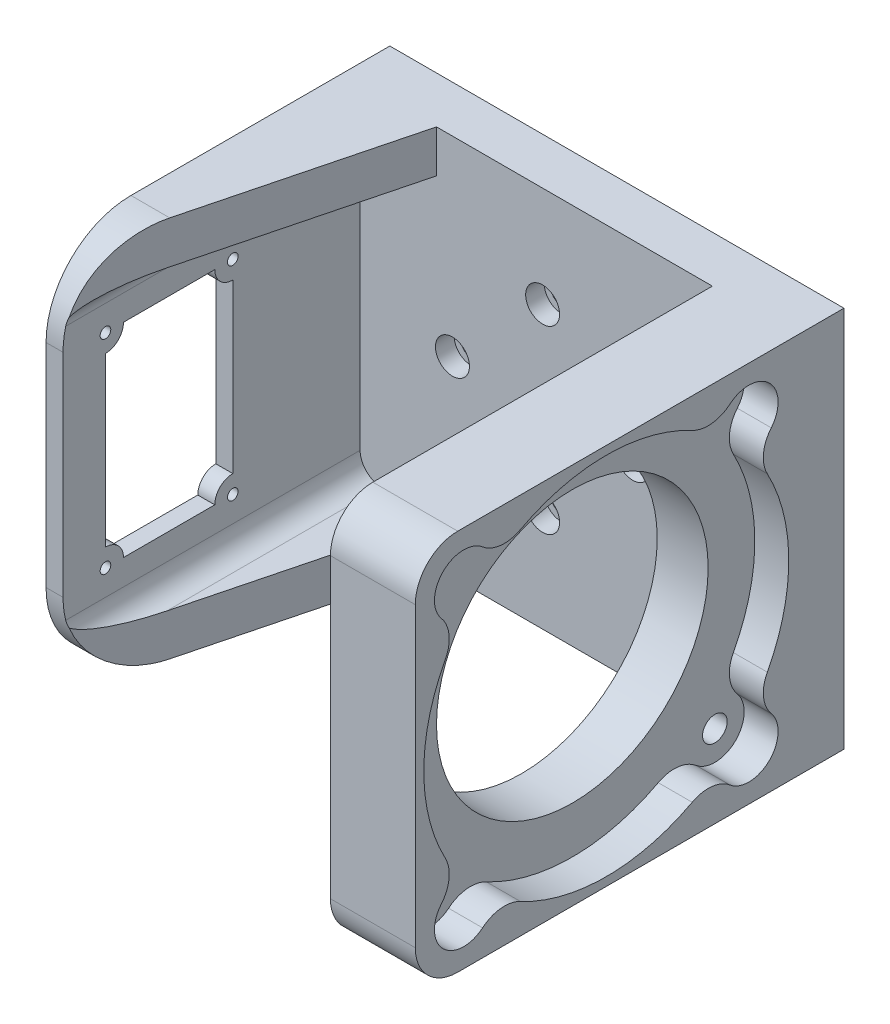
from build123d import *

# Parameters (mm, degrees)
SKETCH1_W                                           = 120
SKETCH1_H                                           = 90
SKETCH1_R                                           = 41.25
BOSS_EXTRUDE1_DEPTH                                 = 3
SKETCH2_W                                           = 120
SKETCH2_H                                           = 90
BOSS_EXTRUDE2_DEPTH                                 = 8
CBORE_FOR_M4_HEX_SOCKET_HEAD_CAP_SCREW1_D           = 4.8
CBORE_FOR_M4_HEX_SOCKET_HEAD_CAP_SCREW1_CBORE_D     = 8
CBORE_FOR_M4_HEX_SOCKET_HEAD_CAP_SCREW1_CBORE_DEPTH = 4.4
SKETCH5_W                                           = 20
SKETCH5_H                                           = 90
BOSS_EXTRUDE3_DEPTH                                 = 90
SKETCH8_R                                           = 32
CUT_EXTRUDE3_DEPTH                                  = 150.083869013
M5_CLEARANCE_HOLE1_D                                = 5.8
CUT_EXTRUDE4_START                                  = -8
SKETCH13_R                                          = 43
SKETCH13_R_2                                        = 6.9
SKETCH13_R_3                                        = 2.9
SKETCH13_R_4                                        = 32
CUT_EXTRUDE4_DEPTH                                  = 8
FILLET1_R                                           = 8
SKETCH14_W                                          = 17
SKETCH14_H                                          = 90
BOSS_EXTRUDE4_DEPTH                                 = 70
TAP_DRILL_FOR_M3_TAP2_D                             = 2.5
CUT_EXTRUDE5_DEPTH                                  = 152.112541008
SKETCH21_W                                          = 81
SKETCH21_H                                          = 90
CUT_EXTRUDE6_DEPTH                                  = 13
BOSS_EXTRUDE5_DEPTH                                 = 10
BOSS_EXTRUDE6_START                                 = -90
BOSS_EXTRUDE6_DEPTH                                 = 10
FILLET3_R                                           = 5
FILLET2_R                                           = 20
FILLET4_R                                           = 10


with BuildPart() as part:
    # Sketch1 → Boss-Extrude1 (new body)
    with BuildSketch(Plane.XY):
        Rectangle(SKETCH1_W, SKETCH1_H)
        Circle(SKETCH1_R, mode=Mode.SUBTRACT)
    extrude(amount=BOSS_EXTRUDE1_DEPTH)

    # Sketch2 → Boss-Extrude2 (add)
    with BuildSketch(Plane.XY.offset(3)):
        Rectangle(SKETCH2_W, SKETCH2_H)
    extrude(amount=BOSS_EXTRUDE2_DEPTH)

    # CBORE for M4 Hex Socket Head Cap Screw1 (through all)
    with Locations(Plane.XY.offset(11)):
        with Locations((-21.25, 0), (0, 21.25), (21.25, 0), (0, -21.25)):
            CounterBoreHole(CBORE_FOR_M4_HEX_SOCKET_HEAD_CAP_SCREW1_D / 2, CBORE_FOR_M4_HEX_SOCKET_HEAD_CAP_SCREW1_CBORE_D / 2, CBORE_FOR_M4_HEX_SOCKET_HEAD_CAP_SCREW1_CBORE_DEPTH)

    # Sketch5 → Boss-Extrude3 (add)
    with BuildSketch(Plane.XY.offset(11)):
        with Locations((50, 0)):
            Rectangle(SKETCH5_W, SKETCH5_H)
    extrude(amount=BOSS_EXTRUDE3_DEPTH)

    # Sketch8 → Cut-Extrude3 (cut, through all)
    with BuildSketch(Plane.ZY.offset(-40)):
        with Locations(Location((56, 0, 0), (0, 0, 270))):
            Circle(SKETCH8_R)
    extrude(amount=-CUT_EXTRUDE3_DEPTH, mode=Mode.SUBTRACT)

    # M5 Clearance Hole1 (through all)
    with Locations(Plane(origin=(60, 0, 0), x_dir=(0, 0, -1), z_dir=(1, 0, 0))):
        with Locations((-22.412427894, -33.587572106), (-89.587572106, -33.587572106), (-89.587572106, 33.587572106), (-22.412427894, 33.587572106)):
            Hole(M5_CLEARANCE_HOLE1_D / 2)

    # Sketch13 → Cut-Extrude4 (cut)
    # profile 1 of 22: a face of its own
    with BuildSketch(Plane(origin=(60, 0, 0), x_dir=(0, 0, -1), z_dir=(1, 0, 0)).offset(CUT_EXTRUDE4_START)):
        with Locations((-56, 0)):
            Circle(SKETCH13_R)
    # profile 2 of 22: a face of its own
    with BuildSketch(Plane(origin=(60, 0, 0), x_dir=(0, 0, -1), z_dir=(1, 0, 0)).offset(CUT_EXTRUDE4_START)):
        with Locations((-89.587572106, 33.587572106)):
            Circle(SKETCH13_R_2)
        with Locations((-89.587572106, 33.587572106)):
            Circle(SKETCH13_R_3, mode=Mode.SUBTRACT)
    # profile 3 of 22: a face of its own
    with BuildSketch(Plane(origin=(60, 0, 0), x_dir=(0, 0, -1), z_dir=(1, 0, 0)).offset(CUT_EXTRUDE4_START)):
        with Locations((-56, 0)):
            Circle(SKETCH13_R)
    # profile 4 of 22: a face of its own
    with BuildSketch(Plane(origin=(60, 0, 0), x_dir=(0, 0, -1), z_dir=(1, 0, 0)).offset(CUT_EXTRUDE4_START)):
        with Locations((-89.587572106, 33.587572106)):
            Circle(SKETCH13_R_2)
    # profile 5 of 22: a face of its own
    with BuildSketch(Plane(origin=(60, 0, 0), x_dir=(0, 0, -1), z_dir=(1, 0, 0)).offset(CUT_EXTRUDE4_START)):
        with Locations((-22.412427894, 33.587572106)):
            Circle(SKETCH13_R_2)
    # profile 6 of 22: a face of its own
    with BuildSketch(Plane(origin=(60, 0, 0), x_dir=(0, 0, -1), z_dir=(1, 0, 0)).offset(CUT_EXTRUDE4_START)):
        with Locations((-56, 0)):
            Circle(SKETCH13_R)
        with Locations(Location((-56, 0, 0), (0, 0, 270))):
            Circle(SKETCH13_R_4, mode=Mode.SUBTRACT)
    # profile 7 of 22: a face of its own
    with BuildSketch(Plane(origin=(60, 0, 0), x_dir=(0, 0, -1), z_dir=(1, 0, 0)).offset(CUT_EXTRUDE4_START)):
        with Locations((-89.587572106, 33.587572106)):
            Circle(SKETCH13_R_2)
    # profile 8 of 22: a face of its own
    with BuildSketch(Plane(origin=(60, 0, 0), x_dir=(0, 0, -1), z_dir=(1, 0, 0)).offset(CUT_EXTRUDE4_START)):
        with Locations((-89.587572106, -33.587572106)):
            Circle(SKETCH13_R_2)
    # profile 9 of 22: a face of its own
    with BuildSketch(Plane(origin=(60, 0, 0), x_dir=(0, 0, -1), z_dir=(1, 0, 0)).offset(CUT_EXTRUDE4_START)):
        with Locations((-22.412427894, -33.587572106)):
            Circle(SKETCH13_R_2)
    # profile 10 of 22: a face of its own
    with BuildSketch(Plane(origin=(60, 0, 0), x_dir=(0, 0, -1), z_dir=(1, 0, 0)).offset(CUT_EXTRUDE4_START)):
        with Locations((-56, 0)):
            Circle(SKETCH13_R)
    # profile 11 of 22: a face of its own
    with BuildSketch(Plane(origin=(60, 0, 0), x_dir=(0, 0, -1), z_dir=(1, 0, 0)).offset(CUT_EXTRUDE4_START)):
        with Locations((-22.412427894, 33.587572106)):
            Circle(SKETCH13_R_2)
    # profile 12 of 22: a face of its own
    with BuildSketch(Plane(origin=(60, 0, 0), x_dir=(0, 0, -1), z_dir=(1, 0, 0)).offset(CUT_EXTRUDE4_START)):
        with Locations((-56, 0)):
            Circle(SKETCH13_R)
    # profile 13 of 22: a face of its own
    with BuildSketch(Plane(origin=(60, 0, 0), x_dir=(0, 0, -1), z_dir=(1, 0, 0)).offset(CUT_EXTRUDE4_START)):
        with Locations((-22.412427894, 33.587572106)):
            Circle(SKETCH13_R_2)
        with Locations((-22.412427894, 33.587572106)):
            Circle(SKETCH13_R_3, mode=Mode.SUBTRACT)
    # profile 14 of 22: a face of its own
    with BuildSketch(Plane(origin=(60, 0, 0), x_dir=(0, 0, -1), z_dir=(1, 0, 0)).offset(CUT_EXTRUDE4_START)):
        with Locations((-56, 0)):
            Circle(SKETCH13_R)
    # profile 15 of 22: a face of its own
    with BuildSketch(Plane(origin=(60, 0, 0), x_dir=(0, 0, -1), z_dir=(1, 0, 0)).offset(CUT_EXTRUDE4_START)):
        with Locations((-22.412427894, -33.587572106)):
            Circle(SKETCH13_R_2)
    # profile 16 of 22: a face of its own
    with BuildSketch(Plane(origin=(60, 0, 0), x_dir=(0, 0, -1), z_dir=(1, 0, 0)).offset(CUT_EXTRUDE4_START)):
        with Locations((-56, 0)):
            Circle(SKETCH13_R)
    # profile 17 of 22: a face of its own
    with BuildSketch(Plane(origin=(60, 0, 0), x_dir=(0, 0, -1), z_dir=(1, 0, 0)).offset(CUT_EXTRUDE4_START)):
        with Locations((-22.412427894, -33.587572106)):
            Circle(SKETCH13_R_2)
        with Locations((-22.412427894, -33.587572106)):
            Circle(SKETCH13_R_3, mode=Mode.SUBTRACT)
    # profile 18 of 22: a face of its own
    with BuildSketch(Plane(origin=(60, 0, 0), x_dir=(0, 0, -1), z_dir=(1, 0, 0)).offset(CUT_EXTRUDE4_START)):
        with Locations((-56, 0)):
            Circle(SKETCH13_R)
    # profile 19 of 22: a face of its own
    with BuildSketch(Plane(origin=(60, 0, 0), x_dir=(0, 0, -1), z_dir=(1, 0, 0)).offset(CUT_EXTRUDE4_START)):
        with Locations((-89.587572106, -33.587572106)):
            Circle(SKETCH13_R_2)
    # profile 20 of 22: a face of its own
    with BuildSketch(Plane(origin=(60, 0, 0), x_dir=(0, 0, -1), z_dir=(1, 0, 0)).offset(CUT_EXTRUDE4_START)):
        with Locations((-56, 0)):
            Circle(SKETCH13_R)
    # profile 21 of 22: a face of its own
    with BuildSketch(Plane(origin=(60, 0, 0), x_dir=(0, 0, -1), z_dir=(1, 0, 0)).offset(CUT_EXTRUDE4_START)):
        with Locations((-89.587572106, -33.587572106)):
            Circle(SKETCH13_R_2)
        with Locations((-89.587572106, -33.587572106)):
            Circle(SKETCH13_R_3, mode=Mode.SUBTRACT)
    # profile 22 of 22: a face of its own
    with BuildSketch(Plane(origin=(60, 0, 0), x_dir=(0, 0, -1), z_dir=(1, 0, 0)).offset(CUT_EXTRUDE4_START)):
        with Locations((-22.412427894, -33.587572106)):
            Circle(SKETCH13_R_3)
    extrude(amount=CUT_EXTRUDE4_DEPTH, mode=Mode.SUBTRACT)

    # Fillet1
    fillet1_edges = [part.edges().sort_by_distance(p)[0] for p in [
        (56, 26.688751419, 89.715138257),
        (56, 33.715138257, 82.688751419),
        (56, 33.715138257, 29.311248581),
        (56, 26.688751419, 22.284861743),
        (56, -26.688751419, 22.284861743),
        (56, -33.715138257, 29.311248581),
        (56, -33.715138257, 82.688751419),
        (56, -26.688751419, 89.715138257),
    ]]
    fillet(fillet1_edges, radius=FILLET1_R)

    # Sketch14 → Boss-Extrude4 (add)
    with BuildSketch(Plane.XY.offset(11)):
        with Locations((-51.5, 0)):
            Rectangle(SKETCH14_W, SKETCH14_H)
    extrude(amount=BOSS_EXTRUDE4_DEPTH)

    # Tap Drill for M3 Tap2 (through all)
    with Locations(Plane(origin=(-43, 0, 0), x_dir=(0, 0, -1), z_dir=(1, 0, 0))):
        with Locations((-71, -24), (-71, 24), (-41, -24), (-41, 24)):
            Hole(TAP_DRILL_FOR_M3_TAP2_D / 2)

    # Sketch20 → Cut-Extrude5 (cut, through all)
    with BuildSketch(Plane(origin=(-43, 0, 0), x_dir=(0, 0, -1), z_dir=(1, 0, 0))):
        with BuildLine():
            ThreePointArc((-66.75, 24), (-67.99479618, 20.99479618), (-71, 19.75))
            Line((-71, 19.75), (-71, -19.75))
            ThreePointArc((-71, -19.75), (-67.99479618, -20.99479618), (-66.75, -24))
            Line((-66.75, -24), (-45.25, -24))
            ThreePointArc((-45.25, -24), (-44.00520382, -20.99479618), (-41, -19.75))
            Line((-41, -19.75), (-41, 19.75))
            ThreePointArc((-41, 19.75), (-44.00520382, 20.99479618), (-45.25, 24))
            Line((-45.25, 24), (-66.75, 24))
        make_face()
    extrude(amount=-CUT_EXTRUDE5_DEPTH, mode=Mode.SUBTRACT)

    # Sketch21 → Cut-Extrude6 (cut)
    with BuildSketch(Plane.ZY.offset(60)):
        with Locations((40.5, 0)):
            Rectangle(SKETCH21_W, SKETCH21_H)
    extrude(amount=-CUT_EXTRUDE6_DEPTH, mode=Mode.SUBTRACT)

    # Sketch22 → Boss-Extrude5 (add)
    with BuildSketch(Plane.XZ.offset(45)):
        Polygon((-43, 81), (-25, 11), (-43, 11), align=None)
    extrude(amount=-BOSS_EXTRUDE5_DEPTH)

    # Sketch22<2> → Boss-Extrude6 (add)
    with BuildSketch(Plane.XZ.offset(45).offset(BOSS_EXTRUDE6_START)):
        Polygon((-43, 81), (-25, 11), (-43, 11), align=None)
    extrude(amount=BOSS_EXTRUDE6_DEPTH)

    # Fillet3
    fillet3_edges = [part.edges().sort_by_distance(p)[0] for p in [
        (-43, -35, 46),
        (-43, 35, 46),
    ]]
    fillet(fillet3_edges, radius=FILLET3_R)

    # Fillet2
    # the kernel refuses this fillet: 20 mm, written as the material it takes off along each edge
    with BuildSketch(Plane(origin=(-97, 45, 81), x_dir=(0, -1, 0), z_dir=(1, 0, 0)), Plane(origin=(7, -45, 81), x_dir=(0, 1, 0), z_dir=(-1, 0, 0))) as fillet2_piece_1:
        with BuildLine():
            CenterArc((FILLET2_R, FILLET2_R), FILLET2_R, 180, 90)
            Line((0, FILLET2_R), (0, 0))
            Line((0, 0), (FILLET2_R, 0))
        make_face()
    extrude(amount=104, mode=Mode.SUBTRACT)

    # Fillet4
    fillet4_edges = [part.edges().sort_by_distance(p)[0] for p in [
        (50, 45, 101),
        (50, -45, 101),
    ]]
    fillet(fillet4_edges, radius=FILLET4_R)


solid = part.part
